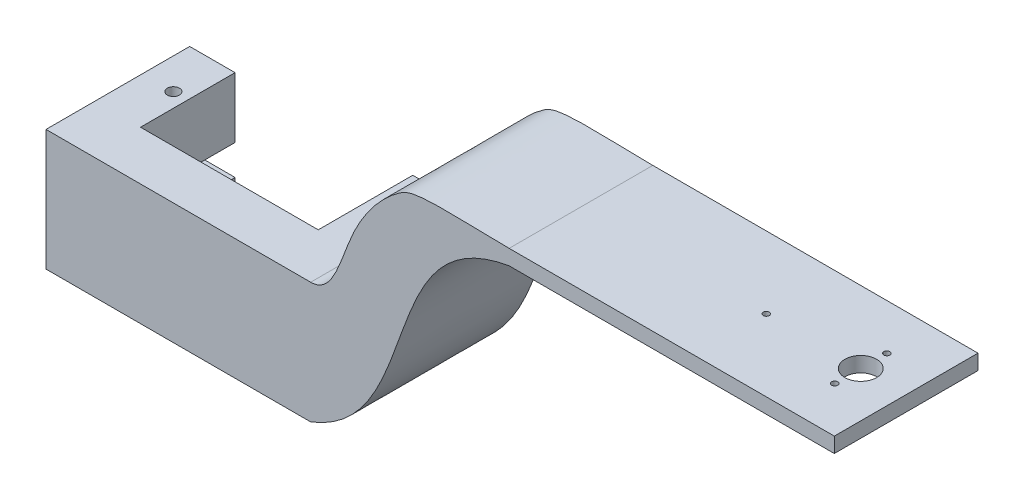
from build123d import *

# Parameters (mm, degrees)
SKETCH1_W            = 35
SKETCH1_H            = 19
BOSS_EXTRUDE1_DEPTH  = 2
SKETCH2_W            = 35
SKETCH2_H            = 19
BOSS_EXTRUDE2_DEPTH  = 14
SKETCH5_W            = 23.5
SKETCH5_H            = 12.5
CUT_EXTRUDE1_DEPTH   = 16
SKETCH6_W            = 12
SKETCH6_H            = 4
CUT_EXTRUDE2_DEPTH   = 35
BOSS_EXTRUDE7_DEPTH  = 19
SKETCH17_W           = 19
SKETCH17_H           = 2
BOSS_EXTRUDE8_DEPTH  = 40
SKETCH10_R           = 0.713910761
BOSS_EXTRUDE9_DEPTH  = 0.5
FILLET2_R            = 0.5
SKETCH18_R           = 0.4
CUT_EXTRUDE6_DEPTH   = 10.5
SKETCH19_R           = 2.1
CUT_EXTRUDE7_DEPTH   = 10.5
SKETCH20_W           = 19
SKETCH20_H           = 2
BOSS_EXTRUDE10_DEPTH = 3
SKETCH7_R            = 0.8
CUT_EXTRUDE8_DEPTH   = 8


with BuildPart() as part:
    # Sketch1 → Boss-Extrude1 (new body)
    with BuildSketch(Plane(origin=(0, 0, 0), x_dir=(1, 0, 0), z_dir=(0, 1, 0))):
        with Locations((-27.5, 0)):
            Rectangle(SKETCH1_W, SKETCH1_H)
    extrude(amount=BOSS_EXTRUDE1_DEPTH)

    # Sketch2 → Boss-Extrude2 (add)
    with BuildSketch(Plane(origin=(0, 0, 0), x_dir=(-1, 0, 0), z_dir=(0, -1, 0))):
        with Locations((27.5, 0)):
            Rectangle(SKETCH2_W, SKETCH2_H)
    extrude(amount=BOSS_EXTRUDE2_DEPTH)

    # Sketch5 → Cut-Extrude1 (cut)
    with BuildSketch(Plane(origin=(0, 2, 0), x_dir=(1, 0, 0), z_dir=(0, 1, 0))):
        with Locations((-27.25, 3.25)):
            Rectangle(SKETCH5_W, SKETCH5_H)
    extrude(amount=-CUT_EXTRUDE1_DEPTH, mode=Mode.SUBTRACT)

    # Sketch6 → Cut-Extrude2 (cut)
    with BuildSketch(Plane.ZY.offset(15.5)):
        with Locations((-4.723551551, -8)):
            Rectangle(SKETCH6_W, SKETCH6_H)
    extrude(amount=CUT_EXTRUDE2_DEPTH, mode=Mode.SUBTRACT)

    # Sketch15 → Boss-Extrude7 (add)
    with BuildSketch(Plane.XY.offset(9.5)):
        with BuildLine():
            Line((16.244255375, 17), (16.244255375, 19))
            add(Edge.make_bspline(
                [(16.244255375, 19), (11.212607589, 19), (4.066469068, 19.553217376), (-0.106803104, 16.983328742), (-5.242294622, 11.037813369), (-6.977758039, 2), (-10, 2)],
                knots=[0, 0, 0, 0, 0.246137696, 0.311425048, 0.652873521, 1, 1, 1, 1], degree=3))
            Line((-10, 2), (-10, -14))
            add(Edge.make_bspline(
                [(-10, -14), (5.215691354, -8.082881299), (-1.571658903, 13.967697147), (16.244255375, 17)],
                knots=[0, 0, 0, 0, 1, 1, 1, 1], degree=3))
        make_face()
    extrude(amount=-BOSS_EXTRUDE7_DEPTH)

    # Sketch17 → Boss-Extrude8 (add)
    with BuildSketch(Plane(origin=(16.244255375, 0, 0), x_dir=(0, 0, -1), z_dir=(1, 0, 0))):
        with Locations((0, 18)):
            Rectangle(SKETCH17_W, SKETCH17_H)
    extrude(amount=BOSS_EXTRUDE8_DEPTH)

    # Sketch10 → Boss-Extrude9 (add)
    with BuildSketch(Plane(origin=(0, -14, 0), x_dir=(-1, 0, 0), z_dir=(0, -1, 0))):
        with Locations(Location((42.426696663, 7.292088489, 0), (0, 0, 90))):
            Circle(SKETCH10_R)
        with Locations(Location((12.850393701, 7.292088489, 0), (0, 0, 90))):
            Circle(SKETCH10_R)
        with Locations(Location((12.850393701, -7.292088489, 0), (0, 0, 270))):
            Circle(SKETCH10_R)
        with Locations(Location((42.426696663, -7.292088489, 0), (0, 0, 270))):
            Circle(SKETCH10_R)
    extrude(amount=BOSS_EXTRUDE9_DEPTH)

    # Fillet2
    fillet2_edges = [part.edges().sort_by_distance(p)[0] for p in [
        (-12.850393701, -14.5, 6.578177728),
        (-42.426696663, -14.5, 6.578177728),
        (-42.426696663, -14.5, -6.578177728),
        (-12.850393701, -14.5, -6.578177728),
    ]]
    fillet(fillet2_edges, radius=FILLET2_R - 0.0001)  # a hair under: the kernel refuses the full size

    # Sketch18 → Cut-Extrude6 (cut)
    with BuildSketch(Plane(origin=(0, 19, 0), x_dir=(1, 0, 0), z_dir=(0, 1, 0))):
        with Locations(Location((53.244255375, 3.45, 0), (0, 0, 270))):
            Circle(SKETCH18_R)
        with Locations(Location((53.244255375, -3.45, 0), (0, 0, 270))):
            Circle(SKETCH18_R)
        with Locations((50.214832051, 25.851748831)):
            Circle(SKETCH18_R)
        with Locations(Location((40.744255375, 0, 0), (0, 0, 270))):
            Circle(SKETCH18_R)
    extrude(amount=-CUT_EXTRUDE6_DEPTH, mode=Mode.SUBTRACT)

    # Sketch19 → Cut-Extrude7 (cut)
    with BuildSketch(Plane(origin=(0, 19, 0), x_dir=(1, 0, 0), z_dir=(0, 1, 0))):
        with Locations(Location((53.244255375, 0, 0), (0, 0, 270))):
            Circle(SKETCH19_R)
    extrude(amount=-CUT_EXTRUDE7_DEPTH, mode=Mode.SUBTRACT)

    # Sketch20 → Boss-Extrude10 (add)
    with BuildSketch(Plane(origin=(56.244255375, 0, 0), x_dir=(0, 0, -1), z_dir=(1, 0, 0))):
        with Locations((0, 18)):
            Rectangle(SKETCH20_W, SKETCH20_H)
    extrude(amount=BOSS_EXTRUDE10_DEPTH)

    # Sketch7 → Cut-Extrude8 (cut)
    with BuildSketch(Plane(origin=(0, 2, 0), x_dir=(1, 0, 0), z_dir=(0, 1, 0))):
        with Locations(Location((-40.9, 3.25, 0), (0, 0, 270))):
            Circle(SKETCH7_R)
        with Locations(Location((-13.6, 3.25, 0), (0, 0, 270))):
            Circle(SKETCH7_R)
    extrude(amount=-CUT_EXTRUDE8_DEPTH, mode=Mode.SUBTRACT)


solid = part.part
